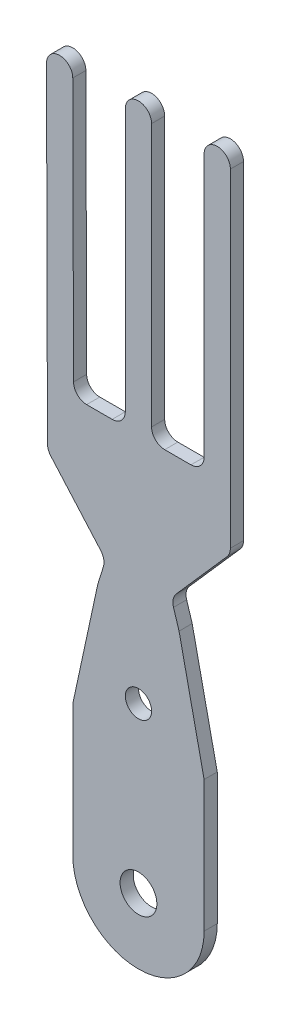
from build123d import *

# Parameters (mm, degrees)
MODEL_R           = 1.4
MODEL_R_2         = 1
BRIDA_BASE1_DEPTH = 1


# Sheet-metal steps are written as plain solids
with BuildPart() as part:
    # Model → Brida base1 (new body)
    with BuildSketch(Plane.XY):
        with BuildLine():
            Line((50.207437074, -7.391699149), (48.298711017, 1.436394934))
            Line((48.298711017, 1.436394934), (47.876387864, 2.792489658))
            ThreePointArc((47.876387864, 2.792489658), (47.852286656, 3.315621633), (48.087445951, 3.783540469))
            Line((48.087445951, 3.783540469), (51.948138549, 8.171489457))
            ThreePointArc((51.948138549, 8.171489457), (52.139383389, 8.489686819), (52.2059904, 8.854909567))
            Line((52.2059904, 8.854909567), (52.2059904, 33.853262145))
            ThreePointArc((52.2059904, 33.853262145), (51.2059904, 34.853262145), (50.2059904, 33.853262145))
            Line((50.2059904, 33.853262145), (50.2059904, 13.851710132))
            ThreePointArc((50.2059904, 13.851710132), (49.912550656, 13.14560465), (49.205991599, 12.853258732))
            Line((49.205991599, 12.853258732), (47.205989201, 12.853258732))
            ThreePointArc((47.205989201, 12.853258732), (46.499430144, 13.14560465), (46.2059904, 13.851710132))
            Line((46.2059904, 13.851710132), (46.2059904, 33.853262145))
            ThreePointArc((46.2059904, 33.853262145), (45.2059904, 34.853262145), (44.2059904, 33.853262145))
            Line((44.2059904, 33.853262145), (44.2059904, 13.853262145))
            ThreePointArc((44.2059904, 13.853262145), (43.913097181, 13.146155364), (43.2059904, 12.853262145))
            Line((43.2059904, 12.853262145), (41.261682565, 12.853262145))
            ThreePointArc((41.261682565, 12.853262145), (40.55729517, 13.146045419), (40.26429965, 13.850344556))
            Line((40.26429965, 13.850344556), (40.2059904, 33.859090521))
            ThreePointArc((40.2059904, 33.859090521), (39.203084692, 34.853266391), (38.2059904, 33.853262145))
            Line((38.2059904, 33.853262145), (38.278848795, 8.854909567))
            ThreePointArc((38.278848795, 8.854909567), (38.330209967, 8.450786945), (38.53359758, 8.097818756))
            Line((38.53359758, 8.097818756), (42.324534849, 3.783540469))
            ThreePointArc((42.324534849, 3.783540469), (42.559377318, 3.315539648), (42.534995737, 2.792489658))
            Line((42.534995737, 2.792489658), (42.111984195, 1.436609508))
            Line((42.111984195, 1.436609508), (40.20743717, -7.393077864))
            Line((40.20743717, -7.393077864), (40.208815885, -17.393077769))
            ThreePointArc((40.208815885, -17.393077769), (45.208815932, -22.393077817), (50.20881598, -17.393077769))
            Line((50.20881598, -17.393077769), (50.207437074, -7.391699149))
        make_face()
        with Locations((45.208815932, -17.393077769)):
            Circle(MODEL_R, mode=Mode.SUBTRACT)
        with Locations((45.208815932, -4.893077769)):
            Circle(MODEL_R_2, mode=Mode.SUBTRACT)
    extrude(amount=-BRIDA_BASE1_DEPTH)


solid = part.part
